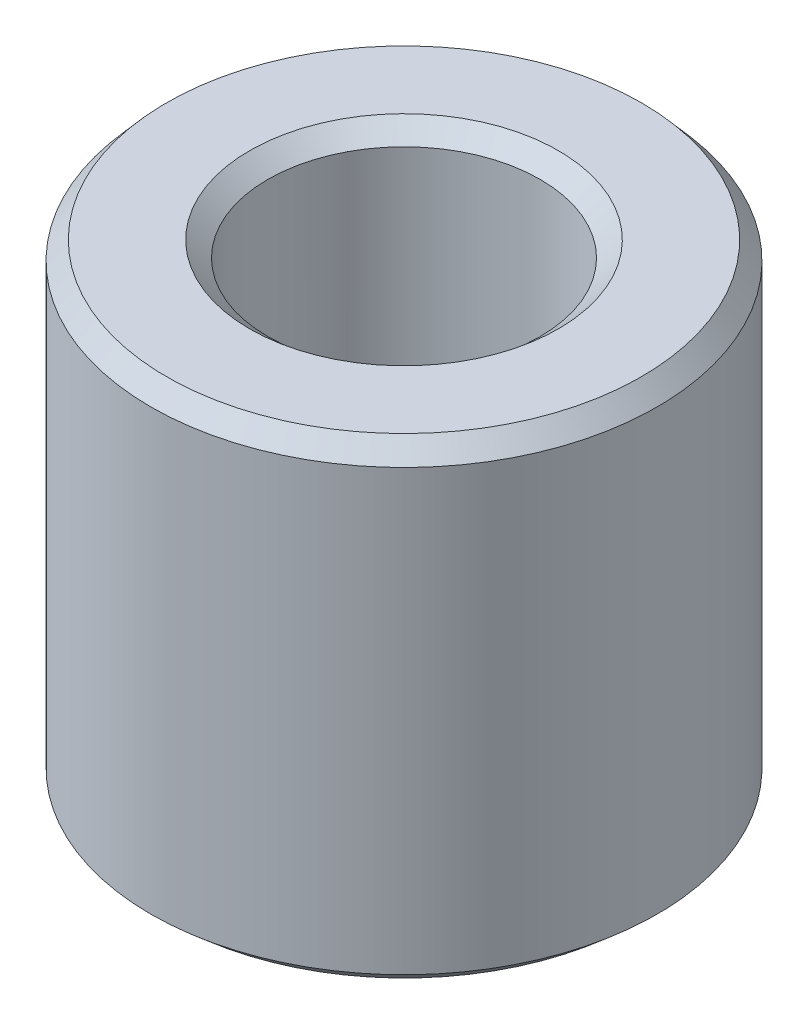
from build123d import *
from OCP.BRepFilletAPI import BRepFilletAPI_MakeChamfer

# Parameters (mm, degrees)
SKETCH1_R           = 52.5
BOSS_EXTRUDE1_DEPTH = 98.165711012
SKETCH2_R           = 28.235914544
CUT_EXTRUDE1_DEPTH  = 124.081301661
CHAMFER1_SIZE       = 3.784684355
CHAMFER1_SIZE2      = 3.268843233


with BuildPart() as part:
    # Sketch1 → Boss-Extrude1 (new body)
    with BuildSketch(Plane(origin=(0, 0, 0), x_dir=(1, 0, 0), z_dir=(0, 1, 0))):
        Circle(SKETCH1_R)
    extrude(amount=BOSS_EXTRUDE1_DEPTH)

    # Sketch2 → Cut-Extrude1 (cut, through all)
    with BuildSketch(Plane(origin=(0, 0, 0), x_dir=(1, 0, 0), z_dir=(0, 1, 0))):
        Circle(SKETCH2_R)
    extrude(amount=CUT_EXTRUDE1_DEPTH, mode=Mode.SUBTRACT)

    # Chamfer1: one chamfer whose edges measure the first distance from different faces: ONE call of the kernel's chamfer builder (chamfer() names one face for all edges)
    chamfer1_edges_1 = [part.edges().sort_by_distance(p)[0] for p in [
        (-28.235914544, 98.165711012, 0),
    ]]
    chamfer1_side_1 = [part.faces().sort_by_distance(p)[0] for p in [
        (-51.01507576, 98.165711012, 0),
    ]]
    chamfer1_edges_2 = [part.edges().sort_by_distance(p)[0] for p in [
        (-28.235914544, 0, 0),
    ]]
    chamfer1_side_2 = [part.faces().sort_by_distance(p)[0] for p in [
        (-28.235914544, 49.082855506, 0),
    ]]
    chamfer1_edges_3 = [part.edges().sort_by_distance(p)[0] for p in [
        (-52.5, 0, 0),
    ]]
    chamfer1_side_3 = [part.faces().sort_by_distance(p)[0] for p in [
        (-51.01507576, 0, 0),
    ]]
    chamfer1_edges_4 = [part.edges().sort_by_distance(p)[0] for p in [
        (-52.5, 98.165711012, 0),
    ]]
    chamfer1_side_4 = [part.faces().sort_by_distance(p)[0] for p in [
        (-52.5, 49.082855506, 0),
    ]]
    chamfer1 = BRepFilletAPI_MakeChamfer(part.part.solid().wrapped)
    for e in chamfer1_edges_1:
        chamfer1.Add(CHAMFER1_SIZE, CHAMFER1_SIZE2, e.wrapped, chamfer1_side_1[0].wrapped)  # the first distance lies on this face
    for e in chamfer1_edges_2:
        chamfer1.Add(CHAMFER1_SIZE, CHAMFER1_SIZE2, e.wrapped, chamfer1_side_2[0].wrapped)  # the first distance lies on this face
    for e in chamfer1_edges_3:
        chamfer1.Add(CHAMFER1_SIZE, CHAMFER1_SIZE2, e.wrapped, chamfer1_side_3[0].wrapped)  # the first distance lies on this face
    for e in chamfer1_edges_4:
        chamfer1.Add(CHAMFER1_SIZE, CHAMFER1_SIZE2, e.wrapped, chamfer1_side_4[0].wrapped)  # the first distance lies on this face
    add(Compound.cast(chamfer1.Shape()), mode=Mode.REPLACE)


solid = part.part
